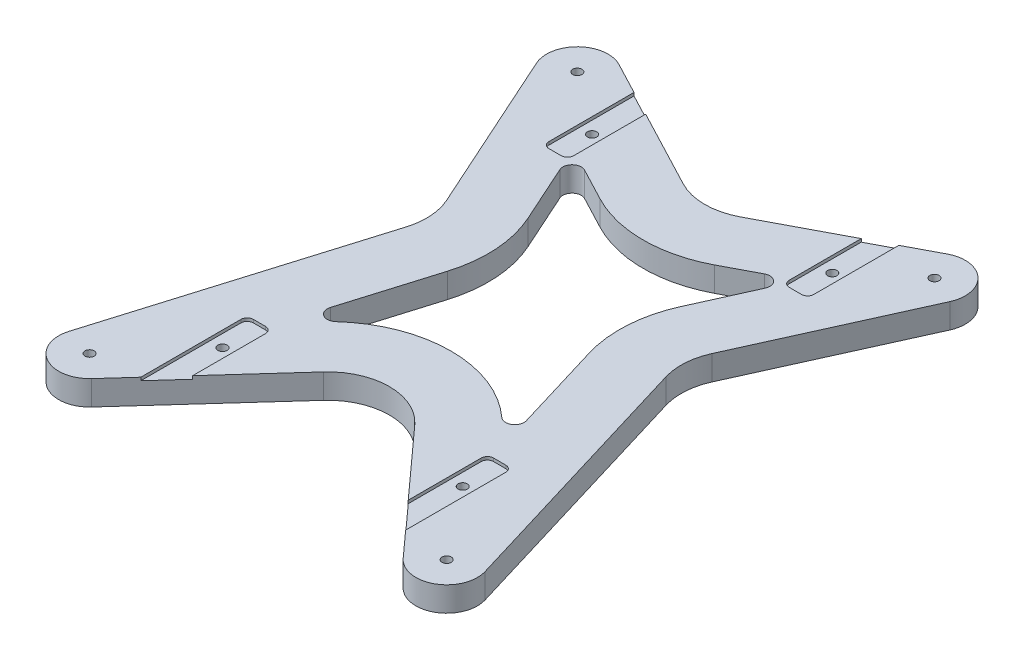
from build123d import *

# Parameters (mm, degrees)
SKETCH1_R           = 1.5
BOSS_EXTRUDE1_DEPTH = 8
FILLET1_R           = 20
CUT_EXTRUDE1_REACH  = 114.435
FILLET2_R           = 3
CUT_EXTRUDE2_DEPTH  = 1


with BuildPart() as part:
    # Sketch1 → Boss-Extrude1 (new body)
    with BuildSketch(Plane(origin=(0, 0, 0), x_dir=(1, 0, 0), z_dir=(0, 1, 0))):
        with BuildLine():
            Line((-53.32799544, 88.046564195), (0, 60))
            Line((0, 60), (53.32799544, 88.046564195))
            ThreePointArc((53.32799544, 88.046564195), (64.836785497, 86.477599448), (67.098537202, 75.084690331))
            Line((67.098537202, 75.084690331), (40, 15))
            Line((40, 15), (67.556265678, -76.306683885))
            ThreePointArc((67.556265678, -76.306683885), (62.901203249, -87.902788837), (50.566513954, -85.904115206))
            Line((50.566513954, -85.904115206), (0, -30))
            Line((0, -30), (-50.566513954, -85.904115206))
            ThreePointArc((-50.566513954, -85.904115206), (-62.901203249, -87.902788837), (-67.556265678, -76.306683885))
            Line((-67.556265678, -76.306683885), (-40, 15))
            Line((-40, 15), (-67.098537202, 75.084690331))
            ThreePointArc((-67.098537202, 75.084690331), (-64.836785497, 86.477599448), (-53.32799544, 88.046564195))
        make_face()
        with Locations((-57.982756057, 79.195959493)):
            Circle(SKETCH1_R, mode=Mode.SUBTRACT)
        with Locations((57.982756057, 79.195959493)):
            Circle(SKETCH1_R, mode=Mode.SUBTRACT)
        with Locations((-57.982756057, -79.195959493)):
            Circle(SKETCH1_R, mode=Mode.SUBTRACT)
        with Locations((57.982756057, -79.195959493)):
            Circle(SKETCH1_R, mode=Mode.SUBTRACT)
        with Locations((-39, 65)):
            Circle(SKETCH1_R, mode=Mode.SUBTRACT)
        with Locations((39, 65)):
            Circle(SKETCH1_R, mode=Mode.SUBTRACT)
        with Locations((39, -55)):
            Circle(SKETCH1_R, mode=Mode.SUBTRACT)
        with Locations((-39, -55)):
            Circle(SKETCH1_R, mode=Mode.SUBTRACT)
    extrude(amount=BOSS_EXTRUDE1_DEPTH)

    # Fillet1
    fillet1_edges = [part.edges().sort_by_distance(p)[0] for p in [
        (0, 4, -60),
        (-40, 4, -15),
        (0, 4, 30),
        (40, 4, -15),
    ]]
    fillet(fillet1_edges, radius=FILLET1_R)

    # Sketch2 → Cut-Extrude1 (cut, up to next)
    with BuildSketch(Plane(origin=(0, 8, 0), x_dir=(1, 0, 0), z_dir=(0, 1, 0)), mode=Mode.PRIVATE) as cut_extrude1_sk1:
        with BuildLine():
            Line((-36.921333333, 56.820552649), (-24.848396623, 30.05162936))
            ThreePointArc((-24.848396623, 30.05162936), (-21.396751184, 16.216367728), (-23.017482718, 2.04945028))
            Line((-23.017482718, 2.04945028), (-35.555196587, -39.493808527))
            Line((-35.555196587, -39.493808527), (-29.664968412, -32.981831159))
            ThreePointArc((-29.664968412, -32.981831159), (0, -19.814454011), (29.664968412, -32.981831159))
            Line((29.664968412, -32.981831159), (35.555196587, -39.493808527))
            Line((35.555196587, -39.493808527), (23.017482718, 2.04945028))
            ThreePointArc((23.017482718, 2.04945028), (21.396751184, 16.216367728), (24.848396623, 30.05162936))
            Line((24.848396623, 30.05162936), (36.921333333, 56.820552649))
            Line((36.921333333, 56.820552649), (18.619042468, 47.194907217))
            ThreePointArc((18.619042468, 47.194907217), (0, 42.597326027), (-18.619042468, 47.194907217))
            Line((-18.619042468, 47.194907217), (-36.921333333, 56.820552649))
        make_face()
    cut_extrude1_tool1 = extrude(cut_extrude1_sk1.sketch, amount=-CUT_EXTRUDE1_REACH, mode=Mode.PRIVATE) & part.part
    add(cut_extrude1_tool1.solids().sort_by_distance((0, 8, -11.13128))[0], mode=Mode.SUBTRACT)

    # Fillet2
    fillet2_edges = [part.edges().sort_by_distance(p)[0] for p in [
        (35.555196587, 4, 39.493808527),
        (-35.555196587, 4, 39.493808527),
        (36.921333333, 4, -56.820552649),
        (-36.921333333, 4, -56.820552649),
    ]]
    fillet(fillet2_edges, radius=FILLET2_R)

    # Sketch4 → Cut-Extrude2 (cut)
    with BuildSketch(Plane(origin=(0, 8, 0), x_dir=(1, 0, 0), z_dir=(0, 1, 0))):
        with BuildLine():
            Line((-37, 53), (-41, 53))
            ThreePointArc((-41, 53), (-42.414213562, 53.585786438), (-43, 55))
            Line((-43, 55), (-43, 82.614805796))
            Line((-43, 82.614805796), (-35, 82.614805796))
            Line((-35, 82.614805796), (-35, 55))
            ThreePointArc((-35, 55), (-35.585786438, 53.585786438), (-37, 53))
        make_face()
        with BuildLine():
            Line((37, 53), (41, 53))
            ThreePointArc((41, 53), (42.414213562, 53.585786438), (43, 55))
            Line((43, 55), (43, 82.614805796))
            Line((43, 82.614805796), (35, 82.614805796))
            Line((35, 82.614805796), (35, 55))
            ThreePointArc((35, 55), (35.585786438, 53.585786438), (37, 53))
        make_face()
        with BuildLine():
            Line((-37, -43), (-41, -43))
            ThreePointArc((-41, -43), (-42.414213562, -43.585786438), (-43, -45))
            Line((-43, -45), (-43, -77.53890996))
            Line((-43, -77.53890996), (-35, -77.53890996))
            Line((-35, -77.53890996), (-35, -45))
            ThreePointArc((-35, -45), (-35.585786438, -43.585786438), (-37, -43))
        make_face()
        with BuildLine():
            Line((37, -43), (41, -43))
            ThreePointArc((41, -43), (42.414213562, -43.585786438), (43, -45))
            Line((43, -45), (43, -77.53890996))
            Line((43, -77.53890996), (35, -77.53890996))
            Line((35, -77.53890996), (35, -45))
            ThreePointArc((35, -45), (35.585786438, -43.585786438), (37, -43))
        make_face()
    extrude(amount=-CUT_EXTRUDE2_DEPTH, mode=Mode.SUBTRACT)


solid = part.part
